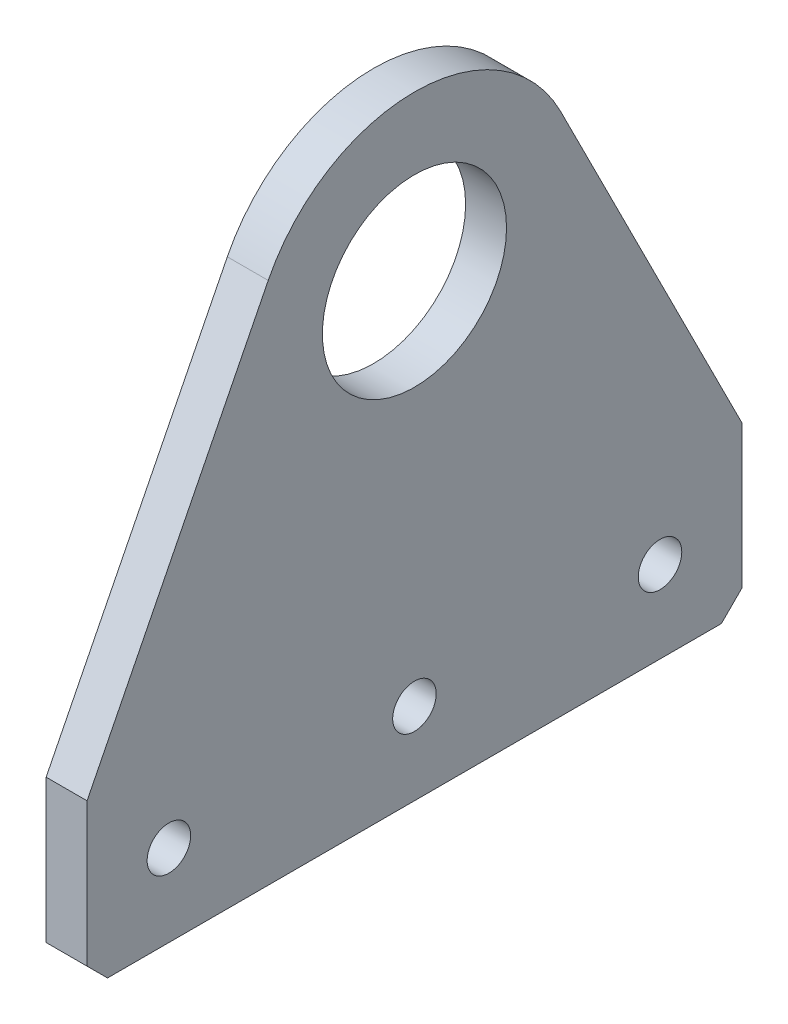
from build123d import *

# Parameters (mm, degrees)
SKETCH1_R           = 14.2875
BOSS_EXTRUDE1_DEPTH = 6.35
SKETCH2_R           = 3.3782
CUT_EXTRUDE1_DEPTH  = 140.411064841
CHAMFER1_SIZE       = 3.175


with BuildPart() as part:
    # Sketch1 → Boss-Extrude1 (new body)
    with BuildSketch(Plane(origin=(0, 0, 0), x_dir=(0, 0, -1), z_dir=(1, 0, 0))):
        with BuildLine():
            Line((0, 0), (0, 25.4))
            Line((0, 25.4), (28.110381264, 81.266707127))
            ThreePointArc((28.110381264, 81.266707127), (50.8, 95.25), (73.489618736, 81.266707127))
            Line((73.489618736, 81.266707127), (101.6, 25.4))
            Line((101.6, 25.4), (101.6, 0))
            Line((101.6, 0), (0, 0))
        make_face()
        with Locations((50.8, 69.85)):
            Circle(SKETCH1_R, mode=Mode.SUBTRACT)
    extrude(amount=BOSS_EXTRUDE1_DEPTH)

    # Sketch2 → Cut-Extrude1 (cut, through all)
    with BuildSketch(Plane(origin=(6.35, 0, 0), x_dir=(0, 0, -1), z_dir=(1, 0, 0))):
        with Locations((12.7, 12.7)):
            Circle(SKETCH2_R)
        with Locations((50.8, 12.7)):
            Circle(SKETCH2_R)
        with Locations((88.9, 12.7)):
            Circle(SKETCH2_R)
    extrude(amount=-CUT_EXTRUDE1_DEPTH, mode=Mode.SUBTRACT)

    # Chamfer1
    chamfer1_edges = [part.edges().sort_by_distance(p)[0] for p in [
        (3.175, 0, -101.6),
        (3.175, 0, 0),
    ]]
    chamfer(chamfer1_edges, length=CHAMFER1_SIZE)


solid = part.part
